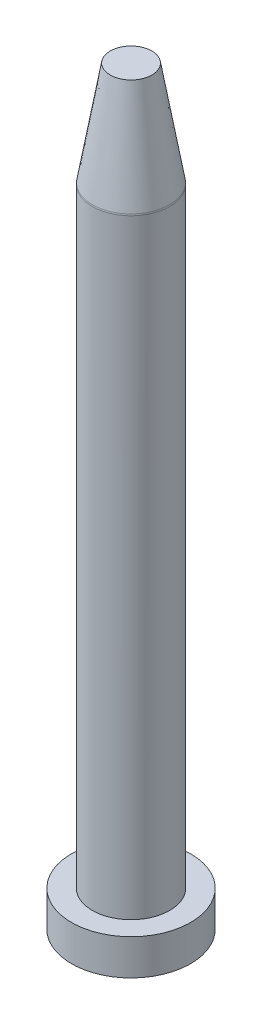
from build123d import *

# Parameters (mm, degrees)
FILLET_1_R = 3


with BuildPart() as part:
    # 草图1 → Revolve 292 (revolve)
    with BuildSketch(Plane.XY):
        Polygon((0, 0), (20, 0), (20, 12), (13, 12), (13, 217), (7, 252), (0, 252), align=None)
    revolve(axis=Axis((0, 0, 0), (0, 1, 0)))

    # 圆角1
    fillet_1_edges = [part.edges().sort_by_distance(p)[0] for p in [
        (-13, 217, 0),
    ]]
    fillet(fillet_1_edges, radius=FILLET_1_R)


solid = part.part
